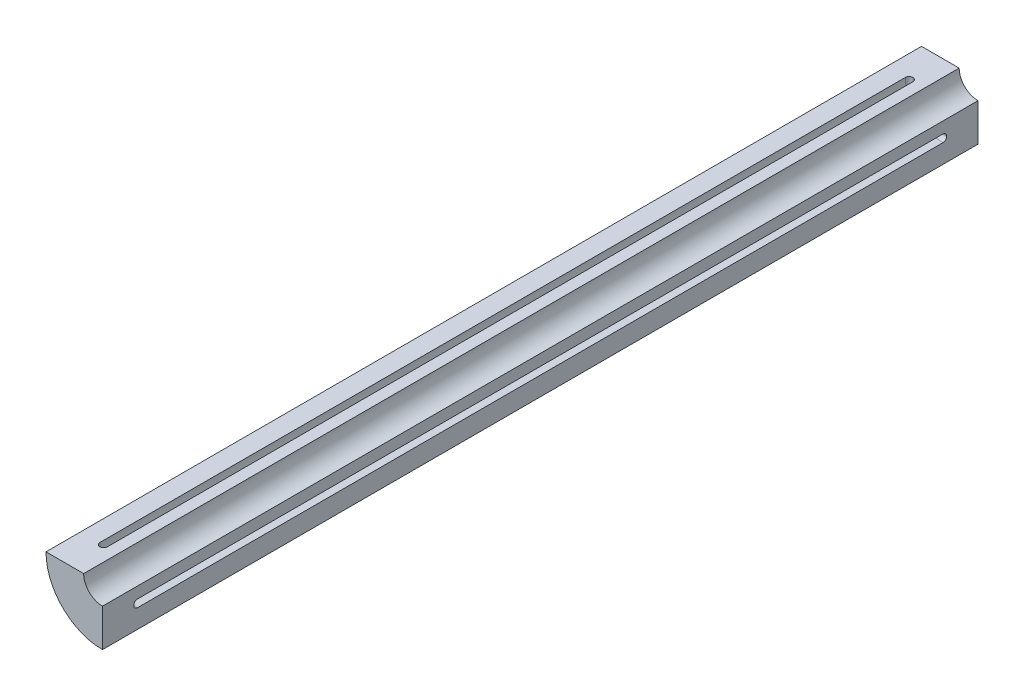
from build123d import *

# Parameters (mm, degrees)
BOSS_EXTRUDE1_DEPTH   = 215.9
BOSS_EXTRUDE1_2_DEPTH = 215.9
BOSS_EXTRUDE2_DEPTH   = 8.3
BOSS_EXTRUDE3_START   = 8.3
BOSS_EXTRUDE3_DEPTH   = 8.3
FILLET1_R             = 1


with BuildPart() as part:
    # Sketch1 → Boss-Extrude1 (new body)
    with BuildSketch(Plane.XY):
        with BuildLine():
            Line((-5, 0.503476918), (-8, 0.503476918))
            ThreePointArc((-8, 0.503476918), (-5.656854249, -5.153377331), (0, -7.496523082))
            Line((0, -7.496523082), (0, -4.496523082))
            ThreePointArc((0, -4.496523082), (-3.535533906, -3.032056988), (-5, 0.503476918))
        make_face()
    extrude(amount=BOSS_EXTRUDE1_DEPTH)



with BuildPart() as body_2:
    # Sketch1 → Boss-Extrude1 2 (new body)
    with BuildSketch(Plane.XY):
        with BuildLine():
            Line((-10, 0.503476918), (-15, 0.503476918))
            ThreePointArc((-15, 0.503476918), (-10.606601718, -10.1031248), (0, -14.496523082))
            Line((0, -14.496523082), (0, -9.496523082))
            ThreePointArc((0, -9.496523082), (-7.071067812, -6.567590894), (-10, 0.503476918))
        make_face()
    extrude(amount=BOSS_EXTRUDE1_2_DEPTH)


with BuildPart() as part_1:
    add(part.part)

    add(body_2.part)  # Boss-Extrude2 merges body 2
    # Sketch2 → Boss-Extrude2 (add)
    with BuildSketch(Plane.XY.offset(215.9)):
        with BuildLine():
            Line((-5, 0.503476918), (-15, 0.503476918))
            ThreePointArc((-15, 0.503476918), (-10.606601718, -10.1031248), (0, -14.496523082))
            Line((0, -14.496523082), (0, -4.496523082))
            ThreePointArc((0, -4.496523082), (-3.535533906, -3.032056988), (-5, 0.503476918))
        make_face()
    extrude(amount=BOSS_EXTRUDE2_DEPTH)

    # Sketch3 → Boss-Extrude3 (add)
    with BuildSketch(Plane(origin=(0, 0, 0), x_dir=(-1, 0, 0), z_dir=(0, 0, -1)).offset(BOSS_EXTRUDE3_START)):
        with BuildLine():
            Line((5, 0.503476918), (15, 0.503476918))
            ThreePointArc((15, 0.503476918), (10.606601718, -10.1031248), (0, -14.496523082))
            Line((0, -14.496523082), (0, -4.496523082))
            ThreePointArc((0, -4.496523082), (3.535533906, -3.032056988), (5, 0.503476918))
        make_face()
    extrude(amount=-BOSS_EXTRUDE3_DEPTH)

    # Fillet1
    fillet1_edges = [part_1.edges().sort_by_distance(p)[0] for p in [
        (-5.656854249, -5.153377331, 0),
        (-7.071067812, -6.567590894, 0),
        (-5.656854249, -5.153377331, 215.9),
        (-7.071067812, -6.567590894, 215.9),
    ]]
    fillet(fillet1_edges, radius=FILLET1_R - 0.0001)  # a hair under: the kernel refuses the full size


solid = part_1.part
